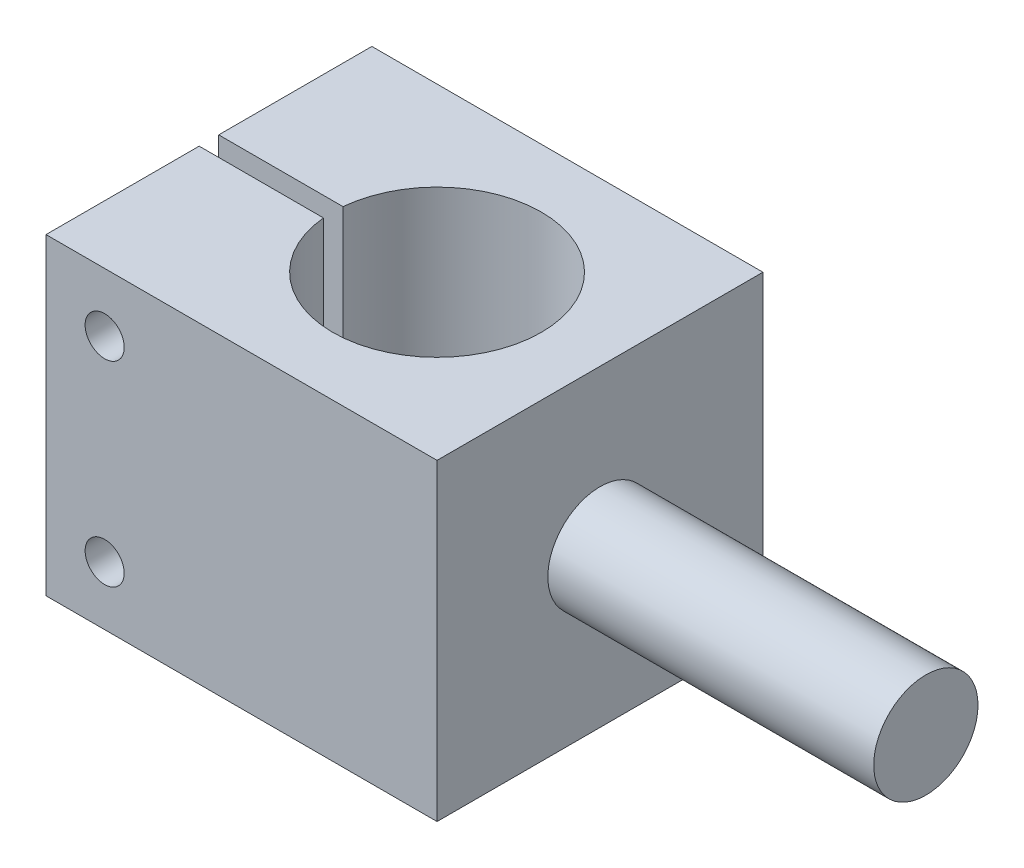
from build123d import *

# Parameters (mm, degrees)
SKETCH1_W           = 30
SKETCH1_H           = 25
BOSS_EXTRUDE1_DEPTH = 24
CUT_EXTRUDE1_DEPTH  = 46.836666545
SKETCH3_R           = 1.5
CUT_EXTRUDE2_DEPTH  = 46.836666545
SKETCH5_R           = 4
BOSS_EXTRUDE3_DEPTH = 18.5
SKETCH4_R           = 4
BOSS_EXTRUDE2_DEPTH = 25


with BuildPart() as part:
    # Sketch1 → Boss-Extrude1 (new body)
    with BuildSketch(Plane(origin=(0, 0, 0), x_dir=(1, 0, 0), z_dir=(0, 1, 0))):
        with Locations((-15, 12.5)):
            Rectangle(SKETCH1_W, SKETCH1_H)
    extrude(amount=BOSS_EXTRUDE1_DEPTH)

    # Sketch2 → Cut-Extrude1 (cut, through all)
    with BuildSketch(Plane.XZ):
        with BuildLine():
            Line((-30, -11.75), (-30, -13.25))
            Line((-30, -13.25), (-20.464766161, -13.25))
            ThreePointArc((-20.464766161, -13.25), (-4.5, -12.5), (-20.464766161, -11.75))
            Line((-20.464766161, -11.75), (-30, -11.75))
        make_face()
    extrude(amount=-CUT_EXTRUDE1_DEPTH, mode=Mode.SUBTRACT)

    # Sketch3 → Cut-Extrude2 (cut, through all)
    with BuildSketch(Plane.XY):
        with Locations((-25.5, 19.5)):
            Circle(SKETCH3_R)
        with Locations((-25.5, 4.5)):
            Circle(SKETCH3_R)
    extrude(amount=-CUT_EXTRUDE2_DEPTH, mode=Mode.SUBTRACT)

    # Sketch5 → Boss-Extrude3 (add)
    with BuildSketch(Plane(origin=(0, 0, 0), x_dir=(0, 0, -1), z_dir=(1, 0, 0))):
        with Locations((12.5, 12)):
            Circle(SKETCH5_R)
    extrude(amount=BOSS_EXTRUDE3_DEPTH)

    # Sketch4 → Boss-Extrude2 (add)
    with BuildSketch(Plane(origin=(0, 0, 0), x_dir=(0, 0, -1), z_dir=(1, 0, 0))):
        with Locations((12.5, 12)):
            Circle(SKETCH4_R)
    extrude(amount=BOSS_EXTRUDE2_DEPTH)


solid = part.part
